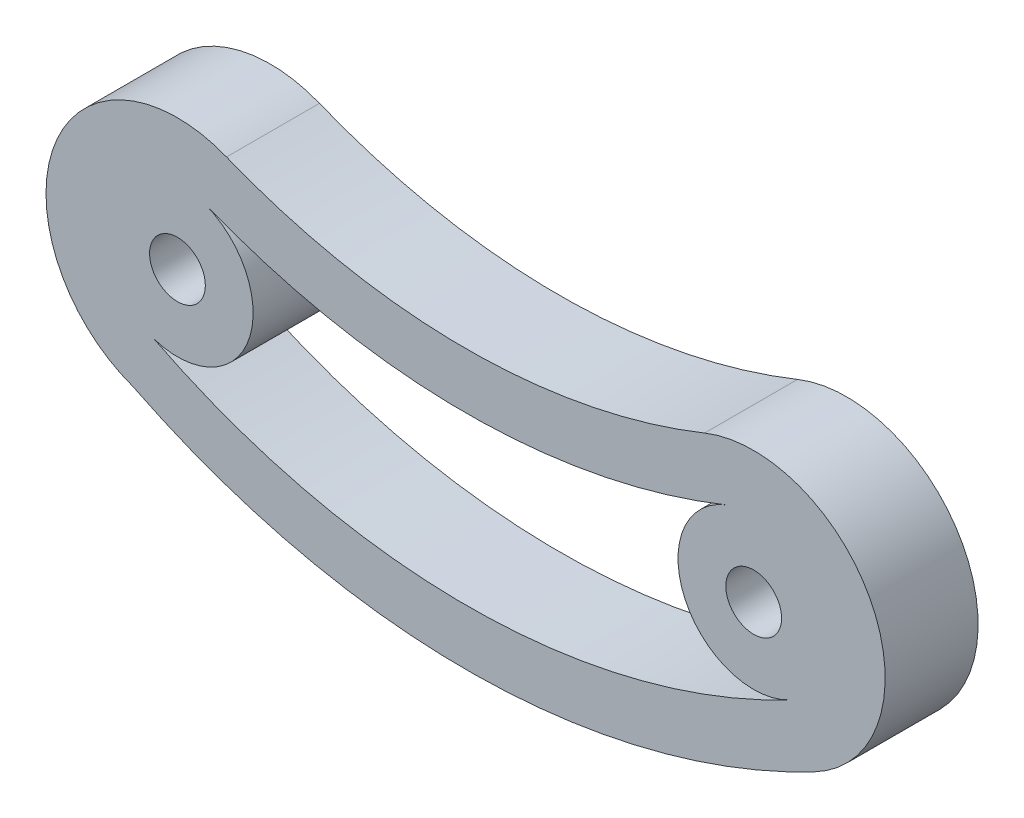
from build123d import *

# Parameters (mm, degrees)
SKETCH1_R           = 1.5
EXTRUDE1_DEPTH      = 5
BOSS_EXTRUDE2_START = -5
BOSS_EXTRUDE2_DEPTH = 5
CUT_EXTRUDE4_START  = -5
CUT_EXTRUDE4_DEPTH  = 5
CUT_EXTRUDE5_DEPTH  = 5
BOSS_EXTRUDE3_DEPTH = 5
BOSS_EXTRUDE4_DEPTH = 5
CUT_EXTRUDE6_DEPTH  = 5


with BuildPart() as part:
    # Sketch1 → Extrude1 (new body)
    with BuildSketch(Plane.XY):
        with BuildLine():
            ThreePointArc((0, 5), (-5, 0), (0, -5))
            Line((0, -5), (31, -5))
            ThreePointArc((31, -5), (36, 0), (31, 5))
            Line((31, 5), (0, 5))
        make_face()
        Circle(SKETCH1_R, mode=Mode.SUBTRACT)
        with BuildLine():
            ThreePointArc((32.5, 0), (31, -1.5), (29.5, 0))
            ThreePointArc((29.5, 0), (31, 1.5), (32.5, 0))
        make_face(mode=Mode.SUBTRACT)
    extrude(amount=EXTRUDE1_DEPTH)

    # Sketch2 → Boss-Extrude2 (add)
    with BuildSketch(Plane.XY.offset(5).offset(BOSS_EXTRUDE2_START)):
        with BuildLine():
            Line((30.833786225, -5), (0.166213775, -5))
            ThreePointArc((0.166213775, -5), (15.5, -10), (30.833786225, -5))
        make_face()
        with BuildLine():
            ThreePointArc((36, 0), (36, 5), (31, 5))
            ThreePointArc((31, 5), (34.535533906, 3.535533906), (36, 0))
        make_face()
        with BuildLine():
            ThreePointArc((-5, 0), (-3.535533906, 3.535533906), (0, 5))
            ThreePointArc((0, 5), (-5, 5), (-5, 0))
        make_face()
    extrude(amount=BOSS_EXTRUDE2_DEPTH)

    # Sketch2<6> → Cut-Extrude4 (cut)
    with BuildSketch(Plane.XY.offset(5).offset(CUT_EXTRUDE4_START)):
        with BuildLine():
            Line((31, 5), (0, 5))
            ThreePointArc((0, 5), (15.5, -1.27314911), (31, 5))
        make_face()
        with BuildLine():
            ThreePointArc((31, -5), (34.535533906, -3.535533906), (36, 0))
            ThreePointArc((36, 0), (33.590468728, -2.679345747), (30.833786225, -5))
            Line((30.833786225, -5), (31, -5))
        make_face()
        with BuildLine():
            ThreePointArc((0.166213775, -5), (-2.590468728, -2.679345747), (-5, 0))
            ThreePointArc((-5, 0), (-3.535533906, -3.535533906), (0, -5))
            Line((0, -5), (0.166213775, -5))
        make_face()
    extrude(amount=CUT_EXTRUDE4_DEPTH, mode=Mode.SUBTRACT)

    # Sketch4 → Cut-Extrude5 (cut)
    with BuildSketch(Plane(origin=(0, 0, 0), x_dir=(-1, 0, 0), z_dir=(0, 0, -1))):
        with BuildLine():
            ThreePointArc((-3.51091514, -1.250156965), (-3.048219787, -2.144241985), (-2.363103689, -2.881867192))
            ThreePointArc((-2.363103689, -2.881867192), (-15.448919013, -6.999943308), (-28.552887179, -2.940000958))
            ThreePointArc((-28.552887179, -2.940000958), (-27.867552839, -2.195390985), (-27.401466144, -1.297120224))
            ThreePointArc((-27.401466144, -1.297120224), (-15.450294399, -4.273100255), (-3.51091514, -1.250156965))
        make_face()
    extrude(amount=-CUT_EXTRUDE5_DEPTH, mode=Mode.SUBTRACT)

    # Sketch5 → Boss-Extrude3 (add)
    with BuildSketch(Plane(origin=(0, 0, 0), x_dir=(-1, 0, 0), z_dir=(0, 0, -1))):
        with BuildLine():
            ThreePointArc((-2.599706958, -6.575828749), (5.911032444, -3.880682343), (4.999999984, 5.000000016))
            ThreePointArc((4.999999984, 5.000000016), (6.035533906, 2.500000011), (5, 0))
            ThreePointArc((5, 0), (1.520730735, -3.658414607), (-2.599706958, -6.575828749))
        make_face()
        with BuildLine():
            ThreePointArc((0, 5), (2.499999989, 6.035533906), (4.999999984, 5.000000016))
            ThreePointArc((4.999999984, 5.000000016), (-2.526282139, 6.604384797), (-7.06048758, 0.386671862))
            ThreePointArc((-7.06048758, 0.386671862), (-3.310013829, 2.356284055), (0, 5))
        make_face()
        with BuildLine():
            ThreePointArc((-36.000000042, 4.999999958), (-36.911032421, -3.880682377), (-28.400293042, -6.575828749))
            ThreePointArc((-28.400293042, -6.575828749), (-32.520730735, -3.658414607), (-36, 0))
            ThreePointArc((-36, 0), (-37.035533906, 2.499999971), (-36.000000042, 4.999999958))
        make_face()
        with BuildLine():
            ThreePointArc((-31, 5), (-27.689986171, 2.356284055), (-23.93951242, 0.386671862))
            ThreePointArc((-23.93951242, 0.386671862), (-28.473717899, 6.604384812), (-36.000000042, 4.999999958))
            ThreePointArc((-36.000000042, 4.999999958), (-33.500000029, 6.035533906), (-31, 5))
        make_face()
    extrude(amount=-BOSS_EXTRUDE3_DEPTH)

    # Sketch6 → Boss-Extrude4 (add)
    with BuildSketch(Plane(origin=(0, 0, 0), x_dir=(-1, 0, 0), z_dir=(0, 0, -1))):
        with BuildLine():
            ThreePointArc((-7.06048758, 0.386671862), (-5.748903613, 4.117050795), (-2.639524867, 6.559947292))
            ThreePointArc((-2.639524867, 6.559947292), (-15.5, 4.069630639), (-28.360475133, 6.559947292))
            ThreePointArc((-28.360475133, 6.559947292), (-25.251096387, 4.117050795), (-23.93951242, 0.386671862))
            ThreePointArc((-23.93951242, 0.386671862), (-15.5, -1.27314911), (-7.06048758, 0.386671862))
        make_face()
        with BuildLine():
            ThreePointArc((-34.288674296, -6.259762086), (-15.993644495, -10.877173454), (2.396097668, -6.652722448))
            ThreePointArc((2.396097668, -6.652722448), (-0.108822543, -7.070230382), (-2.599706958, -6.575828749))
            ThreePointArc((-2.599706958, -6.575828749), (-15.5, -10), (-28.400293042, -6.575828749))
            ThreePointArc((-28.400293042, -6.575828749), (-31.379003341, -7.060903375), (-34.288674296, -6.259762086))
        make_face()
        with BuildLine():
            ThreePointArc((-27.401466144, -1.297120224), (-27.867552839, -2.195390985), (-28.552887179, -2.940000958))
            ThreePointArc((-28.552887179, -2.940000958), (-15.448919013, -6.999943308), (-2.363103689, -2.881867192))
            ThreePointArc((-2.363103689, -2.881867192), (-3.048219787, -2.144241985), (-3.51091514, -1.250156965))
            ThreePointArc((-3.51091514, -1.250156965), (-15.450294399, -4.273100255), (-27.401466144, -1.297120224))
        make_face()
    extrude(amount=-BOSS_EXTRUDE4_DEPTH)

    # Sketch7 → Cut-Extrude6 (cut)
    with BuildSketch(Plane(origin=(0, 0, 0), x_dir=(-1, 0, 0), z_dir=(0, 0, -1))):
        with BuildLine():
            ThreePointArc((-29.480330692, 3.776797363), (-27.626554437, 2.278916006), (-26.928932188, 0))
            ThreePointArc((-26.928932188, 0), (-28.894602064, -3.484378375), (-32.893407958, -3.603969954))
            ThreePointArc((-32.893407958, -3.603969954), (-15.863554262, -7.878266077), (1.233165938, -3.879806039))
            ThreePointArc((1.233165938, -3.879806039), (-3.83098094, -1.377380909), (-1.519669308, 3.776797363))
            ThreePointArc((-1.519669308, 3.776797363), (-15.5, 1.069630639), (-29.480330692, 3.776797363))
        make_face()
    extrude(amount=-CUT_EXTRUDE6_DEPTH, mode=Mode.SUBTRACT)


solid = part.part
